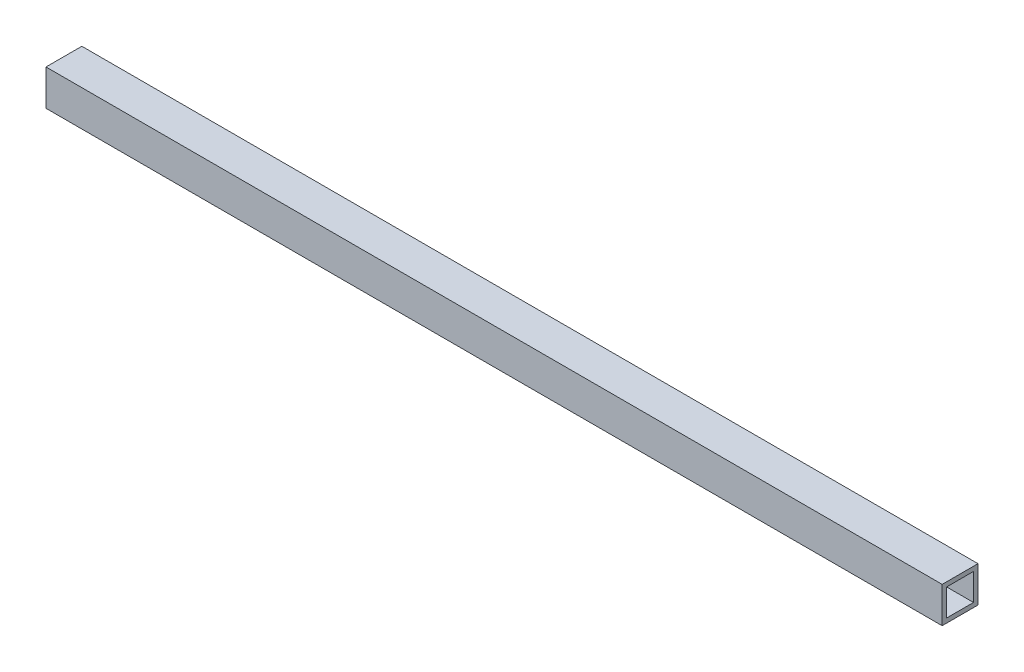
from build123d import *

# Parameters (mm, degrees)
SKETCH1_W           = 25.4
SKETCH1_H           = 25.4
SKETCH1_W_2         = 19.05
SKETCH1_H_2         = 19.05
EXTRUDE_THIN1_DEPTH = 635


with BuildPart() as part:
    # Sketch1 → Extrude-Thin1 (new body)
    with BuildSketch(Plane(origin=(0, 0, 0), x_dir=(0, 0, -1), z_dir=(1, 0, 0))):
        with Locations((9.525, 9.525)):
            Rectangle(SKETCH1_W, SKETCH1_H)
        with Locations((9.525, 9.525)):
            Rectangle(SKETCH1_W_2, SKETCH1_H_2, mode=Mode.SUBTRACT)
    extrude(amount=EXTRUDE_THIN1_DEPTH)


solid = part.part
